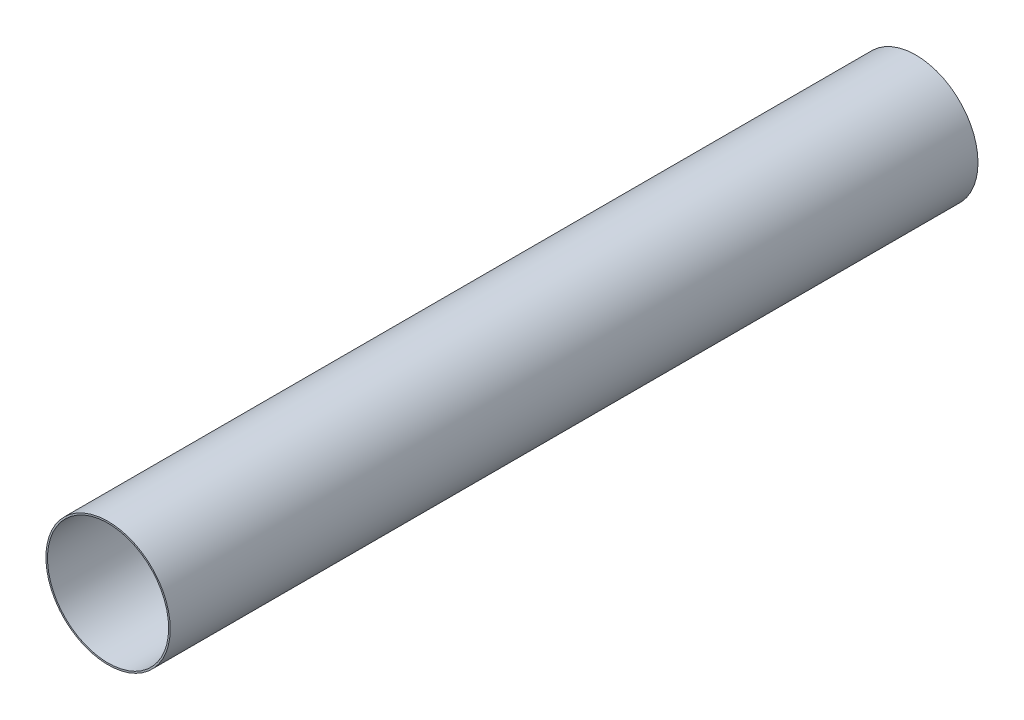
from build123d import *

# Parameters (mm, degrees)
SKETCH1_R           = 78.2
SKETCH1_R_2         = 76.2
BOSS_EXTRUDE1_DEPTH = 508


with BuildPart() as part:
    # Sketch1 → Boss-Extrude1 (new, symmetric)
    with BuildSketch(Plane.XY):
        Circle(SKETCH1_R)
        Circle(SKETCH1_R_2, mode=Mode.SUBTRACT)
    extrude(amount=BOSS_EXTRUDE1_DEPTH, both=True)


solid = part.part
